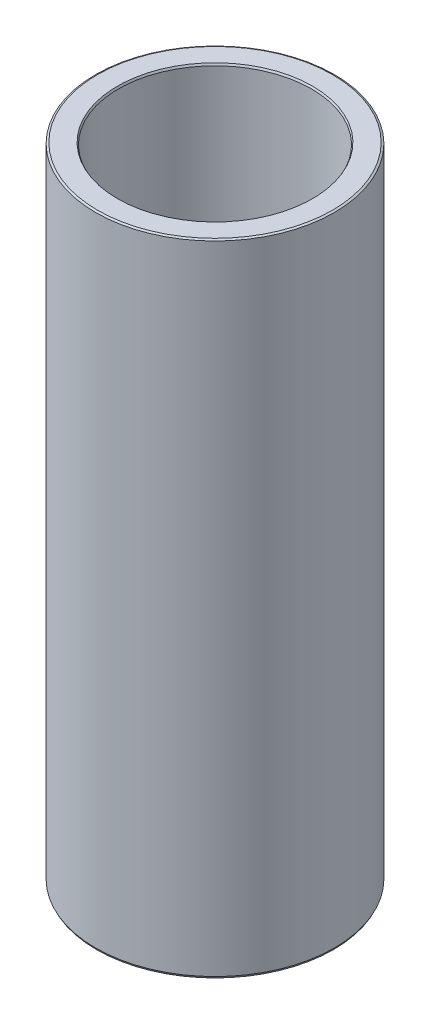
from build123d import *
from OCP.BRepFilletAPI import BRepFilletAPI_MakeChamfer

# Parameters (mm, degrees)
SKETCH1_R           = 30
BOSS_EXTRUDE1_DEPTH = 160.737644982
SKETCH2_R           = 24.25566511
CUT_EXTRUDE1_DEPTH  = 167.24256529
CHAMFER1_SIZE       = 0.244898149
CHAMFER1_SIZE2      = 0.483999982


with BuildPart() as part:
    # Sketch1 → Boss-Extrude1 (new body)
    with BuildSketch(Plane(origin=(0, 0, 0), x_dir=(1, 0, 0), z_dir=(0, 1, 0))):
        Circle(SKETCH1_R)
    extrude(amount=BOSS_EXTRUDE1_DEPTH)

    # Sketch2 → Cut-Extrude1 (cut, through all)
    with BuildSketch(Plane(origin=(0, 0, 0), x_dir=(1, 0, 0), z_dir=(0, 1, 0))):
        Circle(SKETCH2_R)
    extrude(amount=CUT_EXTRUDE1_DEPTH, mode=Mode.SUBTRACT)

    # Chamfer1: one chamfer whose edges measure the first distance from different faces: ONE call of the kernel's chamfer builder (chamfer() names one face for all edges)
    chamfer1_edges_1 = [part.edges().sort_by_distance(p)[0] for p in [
        (-24.25566511, 160.737644982, 0),
    ]]
    chamfer1_side_1 = [part.faces().sort_by_distance(p)[0] for p in [
        (-29.151471863, 160.737644982, 0),
    ]]
    chamfer1_edges_2 = [part.edges().sort_by_distance(p)[0] for p in [
        (-24.25566511, 0, 0),
    ]]
    chamfer1_side_2 = [part.faces().sort_by_distance(p)[0] for p in [
        (-24.25566511, 80.368822491, 0),
    ]]
    chamfer1_edges_3 = [part.edges().sort_by_distance(p)[0] for p in [
        (-30, 0, 0),
    ]]
    chamfer1_side_3 = [part.faces().sort_by_distance(p)[0] for p in [
        (-29.151471863, 0, 0),
    ]]
    chamfer1_edges_4 = [part.edges().sort_by_distance(p)[0] for p in [
        (-30, 160.737644982, 0),
    ]]
    chamfer1_side_4 = [part.faces().sort_by_distance(p)[0] for p in [
        (-30, 80.368822491, 0),
    ]]
    chamfer1 = BRepFilletAPI_MakeChamfer(part.part.solid().wrapped)
    for e in chamfer1_edges_1:
        chamfer1.Add(CHAMFER1_SIZE, CHAMFER1_SIZE2, e.wrapped, chamfer1_side_1[0].wrapped)  # the first distance lies on this face
    for e in chamfer1_edges_2:
        chamfer1.Add(CHAMFER1_SIZE, CHAMFER1_SIZE2, e.wrapped, chamfer1_side_2[0].wrapped)  # the first distance lies on this face
    for e in chamfer1_edges_3:
        chamfer1.Add(CHAMFER1_SIZE, CHAMFER1_SIZE2, e.wrapped, chamfer1_side_3[0].wrapped)  # the first distance lies on this face
    for e in chamfer1_edges_4:
        chamfer1.Add(CHAMFER1_SIZE, CHAMFER1_SIZE2, e.wrapped, chamfer1_side_4[0].wrapped)  # the first distance lies on this face
    add(Compound.cast(chamfer1.Shape()), mode=Mode.REPLACE)


solid = part.part
